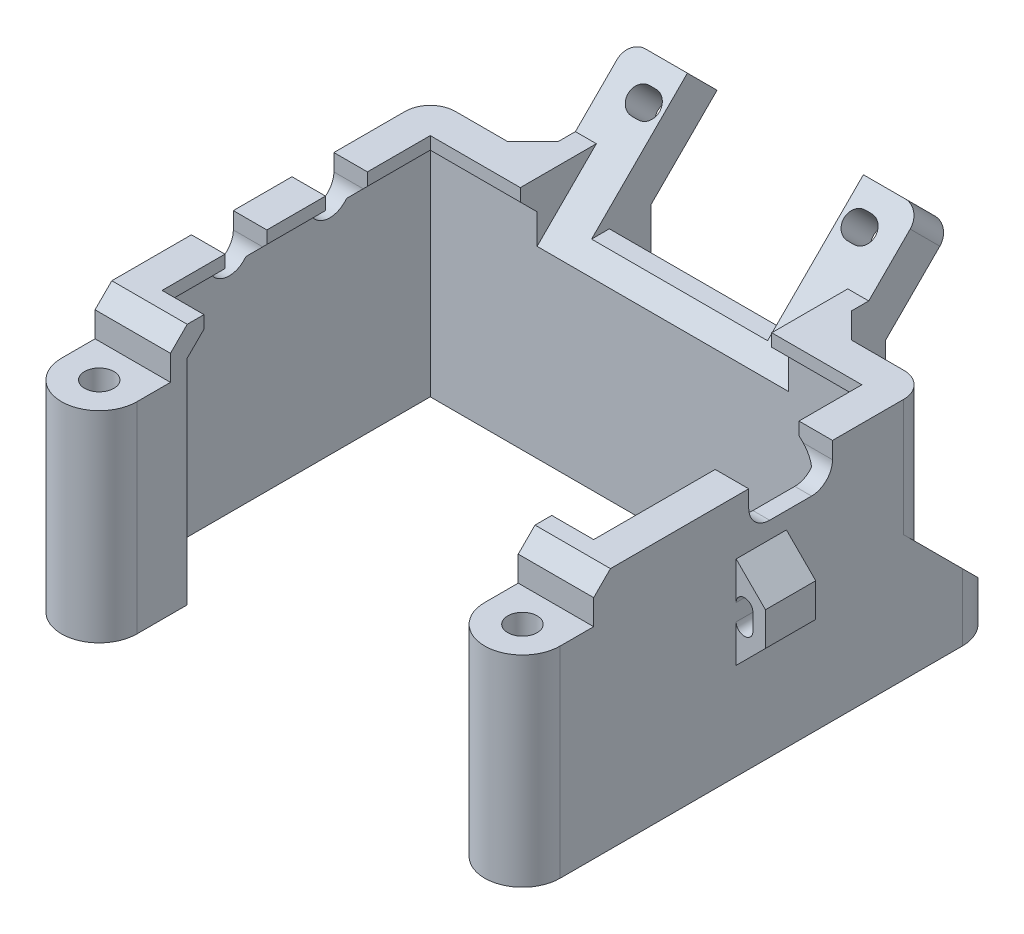
from build123d import *

# Parameters (mm, degrees)
BOSS_EXTRUDE1_DEPTH              = 29
BOSS_EXTRUDE2_START              = -10.5
BOSS_EXTRUDE2_DEPTH              = 7
CUT_EXTRUDE1_DEPTH               = 15
CUT_EXTRUDE2_REACH               = 60.007
BOSS_EXTRUDE4_DEPTH              = 2.5
SKETCH6_W                        = 21
SKETCH6_H                        = 23.928932188
BOSS_EXTRUDE3_DEPTH              = 3
CHAMFER1_SIZE                    = 3
FILLET3_R                        = 2
BOSS_EXTRUDE5_DEPTH              = 3
BOSS_EXTRUDE6_DEPTH              = 24
CHAMFER4_START                   = 3
CHAMFER4_DEPTH                   = 0.53256
CHAMFER4_START_2                 = 3.53256
CHAMFER4_2_DEPTH                 = 8.46744
CHAMFER4_START_3                 = 22.627416998
CHAMFER4_3_DEPTH                 = 7.372583002
SKETCH9_R                        = 1.75
CUT_EXTRUDE4_DEPTH               = 58.953537465
CUT_EXTRUDE5_START               = -3
SKETCH10_R                       = 3
CUT_EXTRUDE5_DEPTH               = 55.953537465
BOSS_EXTRUDE7_DEPTH              = 3.5
CHAMFER5_SIZE                    = 2
FILLET4_R                        = 3
CUT_EXTRUDE6_REACH               = 79.549
CUT_EXTRUDE7_REACH               = 79.549
BOSS_EXTRUDE8_DEPTH              = 3
CUT_EXTRUDE8_DEPTH               = 3
SKETCH17_W                       = 12
SKETCH17_H                       = 10
BOSS_EXTRUDE9_DEPTH              = 23.928932188
BOSS_EXTRUDE10_REACH             = 61.826
BOSS_EXTRUDE10_DIRECTION_2_REACH = 61.826
SKETCH19_W                       = 21
SKETCH19_H                       = 14.671572875
CUT_EXTRUDE9_DEPTH               = 60.877250418
CHAMFER6_SIZE                    = 2


with BuildPart() as part:
    # Sketch1 → Boss-Extrude1 (new body)
    with BuildSketch(Plane(origin=(0, 0, 0), x_dir=(1, 0, 0), z_dir=(0, 1, 0))):
        Polygon((-29.75, 20), (29.75, 20), (29.75, -20), (20.75, -20), (20.75, -18), (27.75, -18), (27.75, 18), (-27.75, 18), (-27.75, -18), (-20.75, -18), (-20.75, -20), (-29.75, -20), align=None)
    extrude(amount=BOSS_EXTRUDE1_DEPTH)

    # Sketch2 → Boss-Extrude2 (add)
    with BuildSketch(Plane(origin=(0, 0, 0), x_dir=(0, 0, -1), z_dir=(1, 0, 0)).offset(BOSS_EXTRUDE2_START)):
        Polygon((18, 0), (18, 21.928932188), (31.435028843, 35.363961031), (34.970562748, 31.828427125), (23, 19.857864376), (23, 0), align=None)
    boss_extrude2 = extrude(amount=-BOSS_EXTRUDE2_DEPTH)

    # Mirror1: Boss-Extrude2 across plane
    add(boss_extrude2.mirror(Plane(origin=(0, 0, 0), x_dir=(0, 0, 1), z_dir=(1, 0, 0))))

    # Sketch3 → Cut-Extrude1 (cut, symmetric)
    with BuildSketch(Plane(origin=(0, 0, 0), x_dir=(0, 0, -1), z_dir=(1, 0, 0))):
        Polygon((18, 21.928932188), (18, 29), (25.071067812, 29), align=None)
    extrude(amount=CUT_EXTRUDE1_DEPTH, both=True, mode=Mode.SUBTRACT)

    # Sketch4 → Cut-Extrude2 (cut, up to next)
    with BuildSketch(Plane(origin=(0, 1.964466094, 1.964466094), x_dir=(1, 0, 0), z_dir=(0, 0.7071067811865483, 0.7071067811865468)), mode=Mode.PRIVATE) as cut_extrude2_sk1:
        with BuildLine():
            Line((-12.5, 41.734018716), (-13.25, 41.734018716))
            ThreePointArc((-13.25, 41.734018716), (-14.75, 43.234018716), (-13.25, 44.734018716))
            Line((-13.25, 44.734018716), (-12.5, 44.734018716))
            ThreePointArc((-12.5, 44.734018716), (-11, 43.234018716), (-12.5, 41.734018716))
        make_face()
    cut_extrude2_tool1 = extrude(cut_extrude2_sk1.sketch, amount=-CUT_EXTRUDE2_REACH, mode=Mode.PRIVATE) & part.part
    # Sketch4 → Cut-Extrude2 (cut, up to next)
    with BuildSketch(Plane(origin=(0, 1.964466094, 1.964466094), x_dir=(1, 0, 0), z_dir=(0, 0.7071067811865483, 0.7071067811865468)), mode=Mode.PRIVATE) as cut_extrude2_sk2:
        with BuildLine():
            Line((12.5, 44.734018716), (13.25, 44.734018716))
            ThreePointArc((13.25, 44.734018716), (14.75, 43.234018716), (13.25, 41.734018716))
            Line((13.25, 41.734018716), (12.5, 41.734018716))
            ThreePointArc((12.5, 41.734018716), (11, 43.234018716), (12.5, 44.734018716))
        make_face()
    cut_extrude2_tool2 = extrude(cut_extrude2_sk2.sketch, amount=-CUT_EXTRUDE2_REACH, mode=Mode.PRIVATE) & part.part
    add(cut_extrude2_tool1.solids().sort_by_distance((-12.875, 32.535534, -28.606602))[0], mode=Mode.SUBTRACT)
    add(cut_extrude2_tool2.solids().sort_by_distance((12.875, 32.535534, -28.606602))[0], mode=Mode.SUBTRACT)

    # Sketch7 → Boss-Extrude4 (add)
    with BuildSketch(Plane.ZY.offset(17.5)):
        Polygon((-25.071067812, 29), (-20, 29), (-20, 23.928932188), align=None)
    boss_extrude4 = extrude(amount=-BOSS_EXTRUDE4_DEPTH)

    # Mirror2: Boss-Extrude4 across plane
    add(boss_extrude4.mirror(Plane(origin=(0, 0, 0), x_dir=(0, 0, 1), z_dir=(1, 0, 0))))

    # Sketch6 → Boss-Extrude3 (add)
    with BuildSketch(Plane(origin=(0, 0, -20), x_dir=(-1, 0, 0), z_dir=(0, 0, -1))):
        with Locations((0, 11.964466094)):
            Rectangle(SKETCH6_W, SKETCH6_H)
    extrude(amount=BOSS_EXTRUDE3_DEPTH)

    # Chamfer1
    chamfer1_edges = [part.edges().sort_by_distance(p)[0] for p in [
        (-17.5, 14.5, -20),
        (17.5, 14.5, -20),
    ]]
    chamfer(chamfer1_edges, length=CHAMFER1_SIZE - 0.0001)  # a hair under: the kernel refuses the full size

    # Fillet3
    fillet3_edges = [part.edges().sort_by_distance(p)[0] for p in [
        (-17.5, 33.596194078, -33.202795796),
        (17.5, 33.596194078, -33.202795796),
    ]]
    fillet(fillet3_edges, radius=FILLET3_R)

    # Sketch8 → Boss-Extrude5 (add)
    with BuildSketch(Plane.XZ):
        with BuildLine():
            Line((-29.75, -20), (-20.75, -20))
            Line((-20.75, -20), (-20.75, -24))
            ThreePointArc((-20.75, -24), (-25.25, -28.5), (-29.75, -24))
            Line((-29.75, -24), (-29.75, -20))
        make_face()
    boss_extrude5 = extrude(amount=-BOSS_EXTRUDE5_DEPTH)

    # Mirror5: Boss-Extrude5 across plane
    add(boss_extrude5.mirror(Plane(origin=(0, 0, 0), x_dir=(0, 0, 1), z_dir=(1, 0, 0))))

    # Sketch11 → Boss-Extrude6 (add)
    with BuildSketch(Plane.XZ):
        with BuildLine():
            Line((-20.75, 20), (-29.75, 20))
            Line((-29.75, 20), (-29.75, 24))
            ThreePointArc((-29.75, 24), (-25.25, 28.5), (-20.75, 24))
            Line((-20.75, 24), (-20.75, 20))
        make_face()
    boss_extrude6 = extrude(amount=-BOSS_EXTRUDE6_DEPTH)

    # Mirror6: Boss-Extrude6 across plane
    add(boss_extrude6.mirror(Plane(origin=(0, 0, 0), x_dir=(0, 0, 1), z_dir=(1, 0, 0))))

    # Chamfer4: read off the stored shape, not the designer's step
    # Chamfer4 outline → Chamfer4 (add)
    with BuildSketch(Plane(origin=(0, 0, 0), x_dir=(1, 0, 0), z_dir=(0, 1, 0)).offset(CHAMFER4_START)):
        with BuildLine():
            Line((20.75, 24), (20.75, 20))
            Line((20.75, 20), (29.75, 20))
            Line((29.75, 20), (29.75, 24))
            ThreePointArc((29.75, 24), (25.25, 28.5), (20.75, 24))
        make_face()
        with BuildLine():
            Line((-29.75, 20), (-20.75, 20))
            Line((-20.75, 20), (-20.75, 24))
            ThreePointArc((-20.75, 24), (-25.25, 28.5), (-29.75, 24))
            Line((-29.75, 24), (-29.75, 20))
        make_face()
    extrude(amount=CHAMFER4_DEPTH)

    # Chamfer4 2 outline → Chamfer4 2 (add)
    with BuildSketch(Plane(origin=(0, 0, 0), x_dir=(1, 0, 0), z_dir=(0, 1, 0)).offset(CHAMFER4_START_2)):
        with BuildLine():
            Line((20.75, 24), (20.75, 20))
            Line((20.75, 20), (29.75, 20))
            Line((29.75, 20), (29.75, 24))
            ThreePointArc((29.75, 24), (25.25, 28.5), (20.75, 24))
        make_face()
        with BuildLine():
            Line((-29.75, 20), (-20.75, 20))
            Line((-20.75, 20), (-20.75, 24))
            ThreePointArc((-20.75, 24), (-25.25, 28.5), (-29.75, 24))
            Line((-29.75, 24), (-29.75, 20))
        make_face()
    extrude(amount=CHAMFER4_2_DEPTH)

    # Chamfer4 3 outline → Chamfer4 3 (cut)
    with BuildSketch(Plane(origin=(0, 0, 0), x_dir=(1, 0, 0), z_dir=(0, 0.707106781186544, -0.707106781186551)).offset(CHAMFER4_START_3)):
        with BuildLine():
            add(Edge.make_bspline(
                [(20.75, 11.313708499), (20.75, 17.67766953), (25.25, 17.67766953), (29.75, 17.67766953), (29.75, 11.313708499)],
                knots=[4.71238898, 4.71238898, 4.71238898, 6.283185307, 6.283185307, 7.853981634, 7.853981634, 7.853981634], degree=2, weights=[1, 0.707106781, 1, 0.707106781, 1]))
            Line((20.75, 11.313708499), (20.75, 5.656854249))
            Line((20.75, 5.656854249), (29.75, 5.656854249))
            Line((29.75, 5.656854249), (29.75, 11.313708499))
        make_face()
        with BuildLine():
            add(Edge.make_bspline(
                [(-29.75, 11.313708499), (-29.75, 17.67766953), (-25.25, 17.67766953), (-20.75, 17.67766953), (-20.75, 11.313708499)],
                knots=[4.71238898, 4.71238898, 4.71238898, 6.283185307, 6.283185307, 7.853981634, 7.853981634, 7.853981634], degree=2, weights=[1, 0.707106781, 1, 0.707106781, 1]))
            Line((-29.75, 11.313708499), (-29.75, 5.656854249))
            Line((-29.75, 5.656854249), (-20.75, 5.656854249))
            Line((-20.75, 5.656854249), (-20.75, 11.313708499))
        make_face()
    extrude(amount=CHAMFER4_3_DEPTH, mode=Mode.SUBTRACT)

    # Sketch9 → Cut-Extrude4 (cut, through all)
    with BuildSketch(Plane.XZ):
        with Locations(Location((-25.25, -24, 0), (0, 0, 270))):
            Circle(SKETCH9_R)
        with Locations(Location((25.25, -24, 0), (0, 0, 270))):
            Circle(SKETCH9_R)
        with Locations(Location((25.25, 24, 0), (0, 0, 270))):
            Circle(SKETCH9_R)
        with Locations(Location((-25.25, 24, 0), (0, 0, 270))):
            Circle(SKETCH9_R)
    extrude(amount=-CUT_EXTRUDE4_DEPTH, mode=Mode.SUBTRACT)

    # Sketch10 → Cut-Extrude5 (cut, through all)
    with BuildSketch(Plane.XZ.offset(CUT_EXTRUDE5_START)):
        with Locations(Location((-25.25, -24, 0), (0, 0, 270))):
            Circle(SKETCH10_R)
        with Locations(Location((25.25, -24, 0), (0, 0, 270))):
            Circle(SKETCH10_R)
    extrude(amount=-CUT_EXTRUDE5_DEPTH, mode=Mode.SUBTRACT)

    # Sketch12 → Boss-Extrude7 (add)
    with BuildSketch(Plane(origin=(0, 29, 0), x_dir=(1, 0, 0), z_dir=(0, 1, 0))):
        Polygon((-20.75, -18), (-27.75, -18), (-27.75, 18), (-15, 18), (-15, 16), (-25.75, 16), (-25.75, -16), (-20.75, -16), align=None)
        Polygon((15, 18), (27.75, 18), (27.75, -18), (20.75, -18), (20.75, -16), (25.75, -16), (25.75, 16), (15, 16), align=None)
    extrude(amount=-BOSS_EXTRUDE7_DEPTH)

    # Chamfer5
    chamfer5_edges = [part.edges().sort_by_distance(p)[0] for p in [
        (23.25, 25.5, 16),
        (25.75, 25.5, 0),
        (20.375, 25.5, -16),
        (-20.375, 25.5, -16),
        (-25.75, 25.5, 0),
        (-23.25, 25.5, 16),
    ]]
    chamfer(chamfer5_edges, length=CHAMFER5_SIZE - 0.0001)  # a hair under: the kernel refuses the full size

    # Fillet4
    fillet4_edges = [part.edges().sort_by_distance(p)[0] for p in [
        (-29.75, 20.5, -20),
        (29.75, 20.5, -20),
    ]]
    fillet(fillet4_edges, radius=FILLET4_R)

    # Sketch13 → Cut-Extrude6 (cut, up to next)
    with BuildSketch(Plane.ZY.offset(29.75), mode=Mode.PRIVATE) as cut_extrude6_sk1:
        with BuildLine():
            Line((-8.5, 29), (-3.5, 29))
            Line((-3.5, 29), (-3.5, 27))
            ThreePointArc((-3.5, 27), (-6, 24.5), (-8.5, 27))
            Line((-8.5, 27), (-8.5, 29))
        make_face()
    cut_extrude6_tool1 = extrude(cut_extrude6_sk1.sketch, amount=-CUT_EXTRUDE6_REACH, mode=Mode.PRIVATE) & part.part
    # Sketch13 → Cut-Extrude6 (cut, up to next)
    with BuildSketch(Plane.ZY.offset(29.75), mode=Mode.PRIVATE) as cut_extrude6_sk2:
        with BuildLine():
            Line((3.5, 27), (3.5, 29))
            Line((3.5, 29), (8.5, 29))
            Line((8.5, 29), (8.5, 27))
            ThreePointArc((8.5, 27), (6, 24.5), (3.5, 27))
        make_face()
    cut_extrude6_tool2 = extrude(cut_extrude6_sk2.sketch, amount=-CUT_EXTRUDE6_REACH, mode=Mode.PRIVATE) & part.part
    add(cut_extrude6_tool1.solids().sort_by_distance((-29.75, 26.978975, -6))[0], mode=Mode.SUBTRACT)
    add(cut_extrude6_tool2.solids().sort_by_distance((-29.75, 26.978975, 6))[0], mode=Mode.SUBTRACT)

    # Sketch14 → Cut-Extrude7 (cut, up to next)
    with BuildSketch(Plane(origin=(29.75, 0, 0), x_dir=(0, 0, -1), z_dir=(1, 0, 0)), mode=Mode.PRIVATE) as cut_extrude7_sk1:
        with BuildLine():
            Line((8.5, 27), (8.5, 29))
            Line((8.5, 29), (-1.5, 29))
            Line((-1.5, 29), (-1.5, 27))
            ThreePointArc((-1.5, 27), (-0.767766953, 25.232233047), (1, 24.5))
            Line((1, 24.5), (6, 24.5))
            ThreePointArc((6, 24.5), (7.767766953, 25.232233047), (8.5, 27))
        make_face()
    cut_extrude7_tool1 = extrude(cut_extrude7_sk1.sketch, amount=-CUT_EXTRUDE7_REACH, mode=Mode.PRIVATE) & part.part
    add(cut_extrude7_tool1.solids().sort_by_distance((29.75, 26.85723, -3.5))[0], mode=Mode.SUBTRACT)

    # Sketch15 → Boss-Extrude8 (add, symmetric)
    with BuildSketch(Plane.XY):
        Polygon((-29.75, 22.5), (-29.75, 11.5), (-33.25, 15), (-33.25, 19), align=None)
    boss_extrude8 = extrude(amount=BOSS_EXTRUDE8_DEPTH, both=True)

    # Sketch16 → Cut-Extrude8 (cut, symmetric)
    with BuildSketch(Plane.XY):
        with BuildLine():
            Line((-29.75, 18), (-29.75, 16))
            ThreePointArc((-29.75, 16), (-30.75, 15), (-31.75, 16))
            Line((-31.75, 16), (-31.75, 18))
            ThreePointArc((-31.75, 18), (-30.75, 19), (-29.75, 18))
        make_face()
    cut_extrude8 = extrude(amount=CUT_EXTRUDE8_DEPTH, both=True, mode=Mode.SUBTRACT)

    # Mirror7: Boss-Extrude8, Cut-Extrude8 across plane
    add(boss_extrude8.mirror(Plane(origin=(0, 0, 0), x_dir=(0, 0, 1), z_dir=(1, 0, 0))))
    add(cut_extrude8.mirror(Plane(origin=(0, 0, 0), x_dir=(0, 0, 1), z_dir=(1, 0, 0))), mode=Mode.SUBTRACT)

    # Sketch17 → Boss-Extrude9 (add)
    with BuildSketch(Plane(origin=(0, 0, 0), x_dir=(1, 0, 0), z_dir=(0, 1, 0))):
        with Locations((0, 28)):
            Rectangle(SKETCH17_W, SKETCH17_H)
    extrude(amount=BOSS_EXTRUDE9_DEPTH)

    # Boss-Extrude10: up to this face of the body (flat: up to its plane)
    boss_extrude10_end = Plane(part.part.faces().sort_by_distance((17.5, 27.632652573, -27.327819921))[0])
    # Sketch18 → Boss-Extrude10 (add, up to the picked face)
    with BuildSketch(Plane(origin=(0, 0, 0), x_dir=(0, 0, -1), z_dir=(1, 0, 0)), mode=Mode.PRIVATE) as boss_extrude10_sk1:
        Polygon((23, 11.928932188), (23, 23.928932188), (27.071067812, 23.928932188), (27.071067812, 16), align=None)
    boss_extrude10_tool1 = split(extrude(boss_extrude10_sk1.sketch, amount=BOSS_EXTRUDE10_REACH, mode=Mode.PRIVATE), bisect_by=boss_extrude10_end, keep=Keep.BOTH, mode=Mode.PRIVATE)
    add(boss_extrude10_tool1.solids().sort_by(Axis((0, 18.877396, -24.896928), (1, 0, 0)))[0])

    # Boss-Extrude10 direction 2: up to this face of the body (flat: up to its plane)
    boss_extrude10_direction_2_end = Plane(part.part.faces().sort_by_distance((-17.5, 27.632652573, -27.327819921))[0])
    # Sketch18 → Boss-Extrude10 direction 2 (add, up to the picked face)
    with BuildSketch(Plane(origin=(0, 0, 0), x_dir=(0, 0, -1), z_dir=(1, 0, 0)), mode=Mode.PRIVATE) as boss_extrude10_direction_2_sk1:
        Polygon((23, 11.928932188), (23, 23.928932188), (27.071067812, 23.928932188), (27.071067812, 16), align=None)
    boss_extrude10_direction_2_tool1 = split(extrude(boss_extrude10_direction_2_sk1.sketch, amount=-BOSS_EXTRUDE10_DIRECTION_2_REACH, mode=Mode.PRIVATE), bisect_by=boss_extrude10_direction_2_end, keep=Keep.BOTH, mode=Mode.PRIVATE)
    add(boss_extrude10_direction_2_tool1.solids().sort_by(Axis((0, 18.877396, -24.896928), (-1, 0, 0)))[0])

    # Sketch19 → Cut-Extrude9 (cut, through all)
    with BuildSketch(Plane(origin=(0, 1.964466094, 1.964466094), x_dir=(1, 0, 0), z_dir=(0, 0.7071067811865487, 0.7071067811865465))):
        with Locations((0, 39.898232279)):
            Rectangle(SKETCH19_W, SKETCH19_H)
    extrude(amount=-CUT_EXTRUDE9_DEPTH, mode=Mode.SUBTRACT)

    # Chamfer6
    chamfer6_edges = [part.edges().sort_by_distance(p)[0] for p in [
        (25.25, 29, 20),
        (-25.25, 29, 20),
    ]]
    chamfer(chamfer6_edges, length=CHAMFER6_SIZE)


solid = part.part
